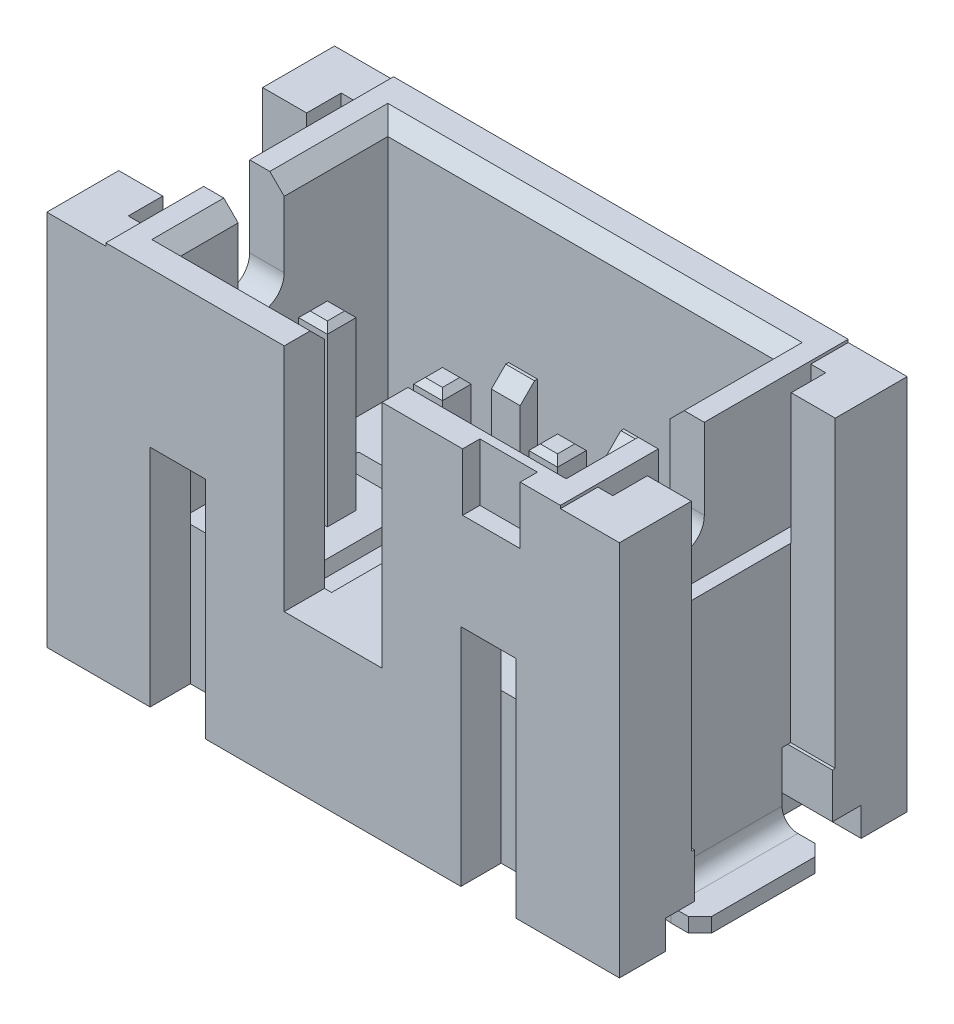
from build123d import *
from OCP.BRepFilletAPI import BRepFilletAPI_MakeChamfer

# Parameters (mm, degrees)
BODY1_W                               = 7.9
BODY1_H                               = 5
EXTRUDE_1_DEPTH                       = 6.6
SKETCH_2_W                            = 6.7
SKETCH_2_H                            = 3.6
CUT_EXTRUDE_1_DEPTH                   = 4.2
SKETCH_5_W                            = 0.8
SKETCH_5_H                            = 3.5
CUT_EXTRUDE_4_DEPTH                   = 0.8
SKETCH_8_W                            = 1.7
SKETCH_8_H                            = 4
CUT_EXTRUDE_6_DEPTH                   = 0.75
CUT_EXTRUDE_7_REACH                   = 13.444
SKETCH_10_W                           = 0.5
SKETCH_10_H                           = 1.6
EXTRUDE_2_DEPTH                       = 0.3
CHAMFER_2_SIZE                        = 0.25
PATTERN_LINEAR_3_COUNT                = 2
PATTERN_LINEAR_3_PITCH                = 2
CHAMFER_2_OF_PATTERN_LINEAR_3_SIZE    = 0.25
EXTRUDE_6_DEPTH                       = 1.025
SKETCH_25_W                           = 2.5
SKETCH_25_H                           = 3
EXTRUDE_10_DEPTH                      = 0.25
SKETCH_26_W                           = 0.26
SKETCH_26_H                           = 3.7
CUT_EXTRUDE_10_DEPTH                  = 2.27
SKETCH_24_W                           = 2.2
SKETCH_24_H                           = 0.25
CHAMFER_13_SIZE                       = 0.2
CHAMFER_13_OF_MIRROR_4_SIZE           = 0.2
CHAMFER_9_SIZE                        = 0.25
SKETCH_27_W                           = 5.95
SKETCH_27_H                           = 4.2
CUT_EXTRUDE_14_DEPTH                  = 0.5
CHAMFER_14_SIZE                       = 0.5
SKETCH_23_W                           = 1
SKETCH_23_H                           = 0.3
CUT_EXTRUDE_9_DEPTH                   = 1
SWEEP_START                           = 1.7
SWEEP_1_DEPTH                         = 0.5
CHAMFER_8_SIZE                        = 0.1
SKETCH_22_W                           = 1.6
SKETCH_22_H                           = 2.55
EXTRUDE_9_DEPTH                       = 0.2
CHAMFER_10_SIZE                       = 0.072794047
CHAMFER_10_SIZE_2                     = 0.2
CHAMFER_11_SIZE2                      = 0.2
CHAMFER_11_SIZE                       = 0.549495484
PATTERN_LINEAR_5_COUNT                = 3
PATTERN_LINEAR_5_PITCH                = 2
CHAMFER_8_OF_PATTERN_LINEAR_5_SIZE    = 0.1
CHAMFER_10_OF_PATTERN_LINEAR_5_SIZE   = 0.072794047
CHAMFER_10_OF_PATTERN_LINEAR_5_SIZE_2 = 0.2
CHAMFER_11_OF_PATTERN_LINEAR_5_SIZE   = 0.549495484
CHAMFER_11_OF_PATTERN_LINEAR_5_SIZE_2 = 0.2
SKETCH_4_W                            = 0.96
SKETCH_4_H                            = 3.91
CUT_EXTRUDE_3_DEPTH                   = 0.7
SKETCH_28_R                           = 0.05
CUT_EXTRUDE_15_DEPTH                  = 0.1


# Read off the part's stored shape, not the designer's step: По траектории1
with BuildPart() as part:
    # Body1 → Бобышка-Вытянуть1 (new body)
    with BuildSketch(Plane(origin=(0, 0, 0), x_dir=(1, 0, 0), z_dir=(0, 1, 0))):
        with Locations((3.95, -2.5)):
            Rectangle(BODY1_W, BODY1_H)
    extrude(amount=EXTRUDE_1_DEPTH)

    # Эскиз2 → Вырез-Вытянуть1 (cut)
    with BuildSketch(Plane(origin=(0, 6.6, 0), x_dir=(1, 0, 0), z_dir=(0, 1, 0))):
        with Locations((3.95, -2.5)):
            Rectangle(SKETCH_2_W, SKETCH_2_H)
    extrude(amount=-CUT_EXTRUDE_1_DEPTH, mode=Mode.SUBTRACT)

    # Эскиз5 → Вырез-Вытянуть4 (cut)
    with BuildSketch(Plane(origin=(0, 0, 4.8), x_dir=(1, 0, 0), z_dir=(0, 1, 0))):
        with Locations((1.95, 3.05)):
            Rectangle(SKETCH_5_W, SKETCH_5_H)
    cut_extrude_4 = extrude(amount=CUT_EXTRUDE_4_DEPTH, mode=Mode.SUBTRACT)

    # Эскиз8 → Вырез-Вытянуть6 (cut)
    with BuildSketch(Plane.XY.offset(4.3)):
        with Locations((3.95, 4.6)):
            Rectangle(SKETCH_8_W, SKETCH_8_H)
    extrude(amount=CUT_EXTRUDE_6_DEPTH, mode=Mode.SUBTRACT)

    # Эскиз9 → Вырез-Вытянуть7 (cut, up to next)
    with BuildSketch(Plane.ZY, mode=Mode.PRIVATE) as cut_extrude_7_sk1:
        with BuildLine():
            Line((2.5, 6.6), (3.3, 6.6))
            Line((3.3, 6.6), (3.3, 5.2))
            ThreePointArc((3.3, 5.2), (2.9, 4.8), (2.5, 5.2))
            Line((2.5, 5.2), (2.5, 6.6))
        make_face()
    cut_extrude_7_tool1 = extrude(cut_extrude_7_sk1.sketch, amount=-CUT_EXTRUDE_7_REACH, mode=Mode.PRIVATE) & part.part
    cut_extrude_7 = cut_extrude_7_tool1.solids().sort_by_distance((0, 5.740595, 2.9))[0]
    add(cut_extrude_7, mode=Mode.SUBTRACT)

    # Зеркальное отражение1: Вырез-Вытянуть7 across plane
    add(cut_extrude_7.mirror(Plane(origin=(3.95, 0, 0), x_dir=(0, 0, 1), z_dir=(1, 0, 0))), mode=Mode.SUBTRACT)

    # Эскиз10 → Бобышка-Вытянуть2 (add)
    with BuildSketch(Plane.XY.offset(0.7)):
        with Locations((2.95, 3.2)):
            Rectangle(SKETCH_10_W, SKETCH_10_H)
    extrude_2 = extrude(amount=EXTRUDE_2_DEPTH)

    # Фаска2
    chamfer_2_edges = [part.edges().sort_by_distance(p)[0] for p in [
        (2.95, 4, 1),
    ]]
    chamfer(chamfer_2_edges, length=CHAMFER_2_SIZE)

    # Линейный массив3: Бобышка-Вытянуть2 ×2
    with Locations(*[(i * PATTERN_LINEAR_3_PITCH, 0, 0) for i in range(1, PATTERN_LINEAR_3_COUNT)]):
        add(extrude_2)

    # Фаска2 of Линейный массив3
    chamfer_2_of_pattern_linear_3_edges = [part.edges().sort_by_distance(p)[0] for p in [
        (4.95, 4, 1),
    ]]
    chamfer(chamfer_2_of_pattern_linear_3_edges, length=CHAMFER_2_OF_PATTERN_LINEAR_3_SIZE)

    # Эскиз19 → Бобышка-Вытянуть6 (add)
    with BuildSketch(Plane.ZY):
        Polygon((5, 6.55), (3.75, 6.55), (3.75, 1.28), (3.7, 1.28), (3.7, 0.5), (4.2, 0.5), (4.2, 0), (5, 0), align=None)
        Polygon((1.25, 6.55), (1.25, 1.28), (1.3, 1.28), (1.3, 0.5), (0.8, 0.5), (0.8, 0), (0, 0), (0, 6.55), align=None)
    extrude_6 = extrude(amount=EXTRUDE_6_DEPTH)

    # Эскиз25 → Бобышка-Вытянуть10 (add)
    with BuildSketch(Plane.ZY):
        with Locations((2.5, 2.78)):
            Rectangle(SKETCH_25_W, SKETCH_25_H)
    extrude_10 = extrude(amount=EXTRUDE_10_DEPTH)

    # Эскиз26 → Вырез-Вытянуть10 (cut)
    with BuildSketch(Plane(origin=(0, 6.55, 0), x_dir=(1, 0, 0), z_dir=(0, 1, 0))):
        with Locations((-0.13, -2.5)):
            Rectangle(SKETCH_26_W, SKETCH_26_H)
    cut_extrude_10 = extrude(amount=-CUT_EXTRUDE_10_DEPTH, mode=Mode.SUBTRACT)

    # По траектории2: sweep along a curve in space
    with BuildLine() as sweep_2_path:
        Line((-0.525, 0, 2.5), (-1.025, 0, 2.5))
        ThreePointArc((-0.125, 0.4, 2.5), (-0.242157288, 0.117157288, 2.5), (-0.525, 0, 2.5))
        Line((-0.125, 0.4, 2.5), (-0.125, 1.28, 2.5))
    # Эскиз24 → По траектории2 (sweep)
    with BuildSketch(Plane.ZY.offset(1.025)):
        with Locations((2.5, 0)):
            Rectangle(SKETCH_24_W, SKETCH_24_H)
    sweep_2 = sweep(path=sweep_2_path.line)

    # Фаска13
    chamfer_13_edges = [part.edges().sort_by_distance(p)[0] for p in [
        (-1.025, 0, 1.4),
        (-1.025, 0, 3.6),
    ]]
    chamfer(chamfer_13_edges, length=CHAMFER_13_SIZE)

    # Зеркальное отражение4: Бобышка-Вытянуть6, Бобышка-Вытянуть10, Вырез-Вытянуть10, По траектории2 across plane
    add(extrude_6.mirror(Plane(origin=(3.95, 0, 0), x_dir=(0, 0, 1), z_dir=(1, 0, 0))))
    add(extrude_10.mirror(Plane(origin=(3.95, 0, 0), x_dir=(0, 0, 1), z_dir=(1, 0, 0))))
    add(cut_extrude_10.mirror(Plane(origin=(3.95, 0, 0), x_dir=(0, 0, 1), z_dir=(1, 0, 0))), mode=Mode.SUBTRACT)
    add(sweep_2.mirror(Plane(origin=(3.95, 0, 0), x_dir=(0, 0, 1), z_dir=(1, 0, 0))))

    # Фаска13 of Зеркальное отражение4
    chamfer_13_of_mirror_4_edges = [part.edges().sort_by_distance(p)[0] for p in [
        (8.925, 0, 1.4),
        (8.925, 0, 3.6),
    ]]
    chamfer(chamfer_13_of_mirror_4_edges, length=CHAMFER_13_OF_MIRROR_4_SIZE)

    # Фаска9
    chamfer_9_edges = [part.edges().sort_by_distance(p)[0] for p in [
        (7.3, 6.6, 3.8),
        (3.95, 6.6, 0.7),
        (0.6, 6.6, 1.6),
        (1.85, 6.6, 4.3),
        (6.05, 6.6, 4.3),
        (0.6, 6.6, 3.8),
        (7.3, 6.6, 1.6),
    ]]
    chamfer(chamfer_9_edges, length=CHAMFER_9_SIZE)

    # Эскиз27 → Вырез-Вытянуть14 (cut)
    with BuildSketch(Plane.XZ):
        with Locations((3.95, 2.1)):
            Rectangle(SKETCH_27_W, SKETCH_27_H)
    extrude(amount=-CUT_EXTRUDE_14_DEPTH, mode=Mode.SUBTRACT)

    # Фаска14
    chamfer_14_edges = [part.edges().sort_by_distance(p)[0] for p in [
        (6.925, 0.5, 2.1),
        (3.95, 0.5, 4.2),
        (0.975, 0.5, 2.1),
    ]]
    chamfer(chamfer_14_edges, length=CHAMFER_14_SIZE - 0.0001)  # a hair under: the kernel refuses the full size

    # Эскиз23 → Вырез-Вытянуть9 (cut)
    with BuildSketch(Plane(origin=(0, 6.6, 0), x_dir=(1, 0, 0), z_dir=(0, 1, 0))):
        with Locations((6.7, -4.85)):
            Rectangle(SKETCH_23_W, SKETCH_23_H)
    extrude(amount=-CUT_EXTRUDE_9_DEPTH, mode=Mode.SUBTRACT)

    # По траектории1 outline → По траектории1 (add)
    with BuildSketch(Plane.YZ.offset(SWEEP_START)):
        with BuildLine():
            add(Edge.make_bspline(
                [(-0.125, 2.425), (-0.125, 2.667776346), (-0.025307849, 2.907839696), (0.231543266, 3.164690811), (0.334064696, 3.233216063), (0.557970954, 3.325961072), (0.695280965, 3.349955156), (0.8, 3.35)],
                knots=[0.430009495, 0.430009495, 0.430009495, 0.430009495, 0.481572991, 0.481572991, 0.507354739, 0.507354739, 0.533136486, 0.533136486, 0.533136486, 0.533136486], degree=3))
            Line((-0.125, 2.425), (-0.125, -1.996089928))
            Line((-0.125, -1.996089928), (0.375, -1.996089928))
            Line((0.375, -1.996089928), (0.375, 2.425))
            add(Edge.make_bspline(
                [(0.375, 2.425), (0.375, 2.536545889), (0.420804502, 2.646845266), (0.538817176, 2.76485794), (0.585921617, 2.796342515), (0.688797466, 2.838955087), (0.728005499, 2.849979396), (0.8, 2.85)],
                knots=[0.430009495, 0.430009495, 0.430009495, 0.430009495, 0.481572991, 0.481572991, 0.507354739, 0.507354739, 0.533136486, 0.533136486, 0.533136486, 0.533136486], degree=3))
            Line((0.8, 2.85), (0.8, 3.35))
        make_face()
        with BuildLine():
            Line((2.4, 3.35), (2.4, 2.85))
            add(Edge.make_bspline(
                [(2.4, 2.85), (2.666666667, 2.85), (2.933333333, 2.85), (4, 2.85), (4.8, 2.85), (5.6, 2.85)],
                knots=[0.688757658, 0.688757658, 0.688757658, 0.688757658, 0.766568243, 0.766568243, 1, 1, 1, 1], degree=3))
            Line((5.6, 2.85), (5.6, 3.35))
            add(Edge.make_bspline(
                [(2.4, 3.35), (2.666666667, 3.35), (2.933333333, 3.35), (4, 3.35), (4.8, 3.35), (5.6, 3.35)],
                knots=[0.688757658, 0.688757658, 0.688757658, 0.688757658, 0.766568243, 0.766568243, 1, 1, 1, 1], degree=3))
        make_face()
    sweep_1 = extrude(amount=SWEEP_1_DEPTH)

    # Фаска8
    chamfer_8_edges = [part.edges().sort_by_distance(p)[0] for p in [
        (1.95, -0.125, -1.996089928),
        (2.2, 0.125, -1.996089928),
        (1.95, 0.375, -1.996089928),
        (1.7, 0.125, -1.996089928),
        (1.95, 5.6, 2.85),
        (2.2, 5.6, 3.1),
        (1.95, 5.6, 3.35),
        (1.7, 5.6, 3.1),
    ]]
    chamfer(chamfer_8_edges, length=CHAMFER_8_SIZE)

    # Эскиз22 → Бобышка-Вытянуть9 (add)
    with BuildSketch(Plane(origin=(0, 2.4, 0), x_dir=(1, 0, 0), z_dir=(0, 1, 0))):
        with Locations((1.95, -3.025)):
            Rectangle(SKETCH_22_W, SKETCH_22_H)
    extrude_9 = extrude(amount=EXTRUDE_9_DEPTH)

    # Фаска10
    chamfer_10_edges_1 = [part.edges().sort_by_distance(p)[0] for p in [
        (1.15, 2.6, 3.025),
    ]]
    chamfer_10_side_1 = [part.faces().sort_by_distance(p)[0] for p in [
        (1.151455881, 2.6, 3.025),
    ]]
    chamfer_10_edges_2 = [part.edges().sort_by_distance(p)[0] for p in [
        (2.75, 2.6, 3.025),
    ]]
    chamfer_10_side_2 = [part.faces().sort_by_distance(p)[0] for p in [
        (2.75, 2.598544119, 3.025),
    ]]
    chamfer_10 = BRepFilletAPI_MakeChamfer(part.part.solid().wrapped)
    for e in chamfer_10_edges_1:
        chamfer_10.Add(CHAMFER_10_SIZE - 0.0001, CHAMFER_10_SIZE_2 - 0.0001, e.wrapped, chamfer_10_side_1[0].wrapped)
    for e in chamfer_10_edges_2:
        chamfer_10.Add(CHAMFER_10_SIZE_2 - 0.0001, CHAMFER_10_SIZE - 0.0001, e.wrapped, chamfer_10_side_2[0].wrapped)
    add(Compound.cast(chamfer_10.Shape()), mode=Mode.REPLACE)  # a hair under: the kernel refuses the full size

    # Фаска11
    chamfer_11_edges = [part.edges().sort_by_distance(p)[0] for p in [
        (1.95, 2.6, 1.75),
    ]]
    chamfer_11_side = [part.faces().sort_by_distance(p)[0] for p in [
        (1.95, 2.6, 1.754),
    ]]
    chamfer(chamfer_11_edges, length=CHAMFER_11_SIZE - 0.0001, length2=CHAMFER_11_SIZE2 - 0.0001, reference=chamfer_11_side[0])  # a hair under: the kernel refuses the full size

    # Линейный массив5: Вырез-Вытянуть4, По траектории1, Бобышка-Вытянуть9 ×3
    with Locations(*[(i * PATTERN_LINEAR_5_PITCH, 0, 0) for i in range(1, PATTERN_LINEAR_5_COUNT)]):
        add(cut_extrude_4, mode=Mode.SUBTRACT)
        add(sweep_1)
        add(extrude_9)

    # Фаска8 of Линейный массив5
    chamfer_8_of_pattern_linear_5_edges = [part.edges().sort_by_distance(p)[0] for p in [
        (3.95, -0.125, -1.996089928),
        (4.2, 0.125, -1.996089928),
        (3.95, 0.375, -1.996089928),
        (3.7, 0.125, -1.996089928),
        (3.95, 5.6, 2.85),
        (4.2, 5.6, 3.1),
        (3.95, 5.6, 3.35),
        (3.7, 5.6, 3.1),
        (5.95, -0.125, -1.996089928),
        (6.2, 0.125, -1.996089928),
        (5.95, 0.375, -1.996089928),
        (5.7, 0.125, -1.996089928),
        (5.95, 5.6, 2.85),
        (6.2, 5.6, 3.1),
        (5.95, 5.6, 3.35),
        (5.7, 5.6, 3.1),
    ]]
    chamfer(chamfer_8_of_pattern_linear_5_edges, length=CHAMFER_8_OF_PATTERN_LINEAR_5_SIZE)

    # Фаска10 of Линейный массив5
    chamfer_10_of_pattern_linear_5_edges_1 = [part.edges().sort_by_distance(p)[0] for p in [
        (3.15, 2.6, 3.025),
    ]]
    chamfer_10_of_pattern_linear_5_side_1 = [part.faces().sort_by_distance(p)[0] for p in [
        (3.151455881, 2.6, 3.025),
    ]]
    chamfer_10_of_pattern_linear_5_edges_2 = [part.edges().sort_by_distance(p)[0] for p in [
        (4.75, 2.6, 3.025),
    ]]
    chamfer_10_of_pattern_linear_5_side_2 = [part.faces().sort_by_distance(p)[0] for p in [
        (4.748544119, 2.6, 3.025),
    ]]
    chamfer_10_of_pattern_linear_5_edges_3 = [part.edges().sort_by_distance(p)[0] for p in [
        (5.15, 2.6, 3.025),
    ]]
    chamfer_10_of_pattern_linear_5_side_3 = [part.faces().sort_by_distance(p)[0] for p in [
        (5.151455881, 2.6, 3.025),
    ]]
    chamfer_10_of_pattern_linear_5_edges_4 = [part.edges().sort_by_distance(p)[0] for p in [
        (6.75, 2.6, 3.025),
    ]]
    chamfer_10_of_pattern_linear_5_side_4 = [part.faces().sort_by_distance(p)[0] for p in [
        (6.75, 2.598544119, 3.025),
    ]]
    chamfer_10_of_pattern_linear_5 = BRepFilletAPI_MakeChamfer(part.part.solid().wrapped)
    for e in chamfer_10_of_pattern_linear_5_edges_1:
        chamfer_10_of_pattern_linear_5.Add(CHAMFER_10_OF_PATTERN_LINEAR_5_SIZE - 0.0001, CHAMFER_10_OF_PATTERN_LINEAR_5_SIZE_2 - 0.0001, e.wrapped, chamfer_10_of_pattern_linear_5_side_1[0].wrapped)
    for e in chamfer_10_of_pattern_linear_5_edges_2:
        chamfer_10_of_pattern_linear_5.Add(CHAMFER_10_OF_PATTERN_LINEAR_5_SIZE - 0.0001, CHAMFER_10_OF_PATTERN_LINEAR_5_SIZE_2 - 0.0001, e.wrapped, chamfer_10_of_pattern_linear_5_side_2[0].wrapped)
    for e in chamfer_10_of_pattern_linear_5_edges_3:
        chamfer_10_of_pattern_linear_5.Add(CHAMFER_10_OF_PATTERN_LINEAR_5_SIZE - 0.0001, CHAMFER_10_OF_PATTERN_LINEAR_5_SIZE_2 - 0.0001, e.wrapped, chamfer_10_of_pattern_linear_5_side_3[0].wrapped)
    for e in chamfer_10_of_pattern_linear_5_edges_4:
        chamfer_10_of_pattern_linear_5.Add(CHAMFER_10_OF_PATTERN_LINEAR_5_SIZE_2 - 0.0001, CHAMFER_10_OF_PATTERN_LINEAR_5_SIZE - 0.0001, e.wrapped, chamfer_10_of_pattern_linear_5_side_4[0].wrapped)
    add(Compound.cast(chamfer_10_of_pattern_linear_5.Shape()), mode=Mode.REPLACE)  # a hair under: the kernel refuses the full size

    # Фаска11 of Линейный массив5
    chamfer_11_of_pattern_linear_5_edges_1 = [part.edges().sort_by_distance(p)[0] for p in [
        (3.95, 2.6, 1.75),
    ]]
    chamfer_11_of_pattern_linear_5_side_1 = [part.faces().sort_by_distance(p)[0] for p in [
        (3.95, 2.6, 1.754),
    ]]
    chamfer_11_of_pattern_linear_5_edges_2 = [part.edges().sort_by_distance(p)[0] for p in [
        (5.95, 2.6, 1.75),
    ]]
    chamfer_11_of_pattern_linear_5_side_2 = [part.faces().sort_by_distance(p)[0] for p in [
        (5.95, 2.6, 1.754),
    ]]
    chamfer_11_of_pattern_linear_5 = BRepFilletAPI_MakeChamfer(part.part.solid().wrapped)
    for e in chamfer_11_of_pattern_linear_5_edges_1:
        chamfer_11_of_pattern_linear_5.Add(CHAMFER_11_OF_PATTERN_LINEAR_5_SIZE - 0.0001, CHAMFER_11_OF_PATTERN_LINEAR_5_SIZE_2 - 0.0001, e.wrapped, chamfer_11_of_pattern_linear_5_side_1[0].wrapped)
    for e in chamfer_11_of_pattern_linear_5_edges_2:
        chamfer_11_of_pattern_linear_5.Add(CHAMFER_11_OF_PATTERN_LINEAR_5_SIZE - 0.0001, CHAMFER_11_OF_PATTERN_LINEAR_5_SIZE_2 - 0.0001, e.wrapped, chamfer_11_of_pattern_linear_5_side_2[0].wrapped)
    add(Compound.cast(chamfer_11_of_pattern_linear_5.Shape()), mode=Mode.REPLACE)  # a hair under: the kernel refuses the full size

    # Эскиз4 → Вырез-Вытянуть3 (cut)
    with BuildSketch(Plane.XY.offset(5)):
        with Locations((1.25, 1.955)):
            Rectangle(SKETCH_4_W, SKETCH_4_H)
        with Locations((6.65, 1.955)):
            Rectangle(SKETCH_4_W, SKETCH_4_H)
    extrude(amount=-CUT_EXTRUDE_3_DEPTH, mode=Mode.SUBTRACT)

    # Эскиз28 → Вырез-Вытянуть15 (cut)
    with BuildSketch(Plane.XZ.offset(0.125)):
        with Locations((-0.525, 2.5)):
            Circle(SKETCH_28_R)
    extrude(amount=-CUT_EXTRUDE_15_DEPTH, mode=Mode.SUBTRACT)


solid = part.part
